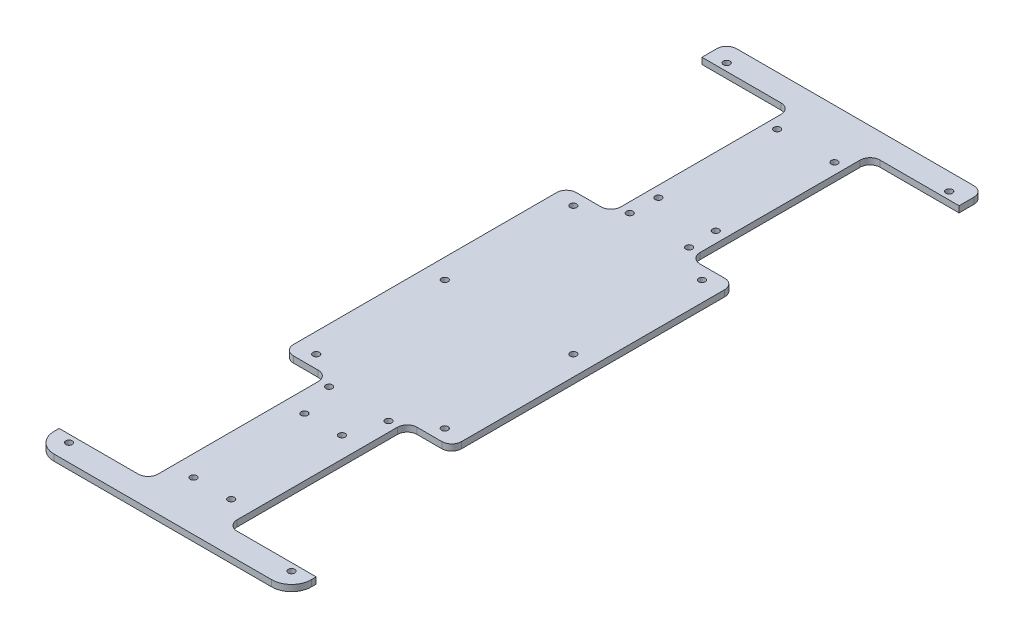
from build123d import *

# Parameters (mm, degrees)
BOSS_EXTRUDE1_DEPTH = 3.175
FILLET1_R           = 10
FILLET2_R           = 5
SKETCH2_R           = 1.65
CUT_EXTRUDE1_DEPTH  = 374.376593569
SKETCH3_R           = 1.65
CUT_EXTRUDE2_DEPTH  = 374.376593569
SKETCH4_R           = 1.65
CUT_EXTRUDE3_DEPTH  = 374.376593569
FILLET3_R           = 5
SKETCH5_R           = 1.65
CUT_EXTRUDE4_DEPTH  = 10
SKETCH6_R           = 1.65
CUT_EXTRUDE5_DEPTH  = 374.376593569


with BuildPart() as part:
    # Sketch1 → Boss-Extrude1 (new body)
    with BuildSketch(Plane(origin=(0, 0, 0), x_dir=(1, 0, 0), z_dir=(0, 1, 0))):
        Polygon((0, 0), (130, 0), (130, 12.5), (85, 12.5), (85, 103.5), (107.5, 103.5), (107.5, 246.5), (85, 246.5), (85, 337.5), (130, 337.5), (130, 350), (0, 350), (0, 337.5), (45, 337.5), (45, 246.5), (22.5, 246.5), (22.5, 103.5), (45, 103.5), (45, 12.5), (0, 12.5), align=None)
    extrude(amount=BOSS_EXTRUDE1_DEPTH)

    # Fillet1
    fillet1_edges = [part.edges().sort_by_distance(p)[0] for p in [
        (130, 1.5875, 0),
        (0, 1.5875, 0),
    ]]
    fillet(fillet1_edges, radius=FILLET1_R)

    # Fillet2
    fillet2_edges = [part.edges().sort_by_distance(p)[0] for p in [
        (0, 1.5875, -350),
        (130, 1.5875, -350),
        (107.5, 1.5875, -246.5),
        (107.5, 1.5875, -103.5),
        (22.5, 1.5875, -103.5),
        (22.5, 1.5875, -246.5),
    ]]
    fillet(fillet2_edges, radius=FILLET2_R)

    # Sketch2 → Cut-Extrude1 (cut, through all)
    with BuildSketch(Plane(origin=(0, 3.175, 0), x_dir=(1, 0, 0), z_dir=(0, 1, 0))):
        with Locations((32.5, 240)):
            Circle(SKETCH2_R)
        with Locations((32.5, 175)):
            Circle(SKETCH2_R)
        with Locations((32.5, 110)):
            Circle(SKETCH2_R)
        with Locations((97.5, 110)):
            Circle(SKETCH2_R)
        with Locations((97.5, 175)):
            Circle(SKETCH2_R)
        with Locations((97.5, 240)):
            Circle(SKETCH2_R)
    extrude(amount=-CUT_EXTRUDE1_DEPTH, mode=Mode.SUBTRACT)

    # Sketch3 → Cut-Extrude2 (cut, through all)
    with BuildSketch(Plane(origin=(0, 3.175, 0), x_dir=(1, 0, 0), z_dir=(0, 1, 0))):
        with Locations((8.75, 8.75)):
            Circle(SKETCH3_R)
        with Locations((121.25, 8.75)):
            Circle(SKETCH3_R)
    extrude(amount=-CUT_EXTRUDE2_DEPTH, mode=Mode.SUBTRACT)

    # Sketch4 → Cut-Extrude3 (cut, through all)
    with BuildSketch(Plane(origin=(0, 3.175, 0), x_dir=(1, 0, 0), z_dir=(0, 1, 0))):
        with Locations((8.75, 341.25)):
            Circle(SKETCH4_R)
        with Locations((121.25, 341.25)):
            Circle(SKETCH4_R)
    extrude(amount=-CUT_EXTRUDE3_DEPTH, mode=Mode.SUBTRACT)

    # Fillet3
    fillet3_edges = [part.edges().sort_by_distance(p)[0] for p in [
        (85, 1.5875, -246.5),
        (45, 1.5875, -246.5),
        (85, 1.5875, -103.5),
        (45, 1.5875, -103.5),
        (45, 1.5875, -12.5),
        (85, 1.5875, -12.5),
        (45, 1.5875, -337.5),
        (85, 1.5875, -337.5),
    ]]
    fillet(fillet3_edges, radius=FILLET3_R)

    # Sketch5 → Cut-Extrude4 (cut)
    with BuildSketch(Plane(origin=(0, 3.175, 0), x_dir=(1, 0, 0), z_dir=(0, 1, 0))):
        with Locations((55.5, 81)):
            Circle(SKETCH5_R)
        with Locations((74.5, 81)):
            Circle(SKETCH5_R)
        with Locations((74.5, 25)):
            Circle(SKETCH5_R)
        with Locations((55.5, 25)):
            Circle(SKETCH5_R)
        with Locations((79.5, 325)):
            Circle(SKETCH5_R)
        with Locations((50.5, 325)):
            Circle(SKETCH5_R)
        with Locations((79.5, 265)):
            Circle(SKETCH5_R)
        with Locations((50.5, 265)):
            Circle(SKETCH5_R)
    extrude(amount=-CUT_EXTRUDE4_DEPTH, mode=Mode.SUBTRACT)

    # Sketch6 → Cut-Extrude5 (cut, through all)
    with BuildSketch(Plane(origin=(0, 3.175, 0), x_dir=(1, 0, 0), z_dir=(0, 1, 0))):
        with Locations((80, 99)):
            Circle(SKETCH6_R)
        with Locations((50, 99)):
            Circle(SKETCH6_R)
        with Locations((80, 251)):
            Circle(SKETCH6_R)
        with Locations((50, 251)):
            Circle(SKETCH6_R)
    extrude(amount=-CUT_EXTRUDE5_DEPTH, mode=Mode.SUBTRACT)


solid = part.part
